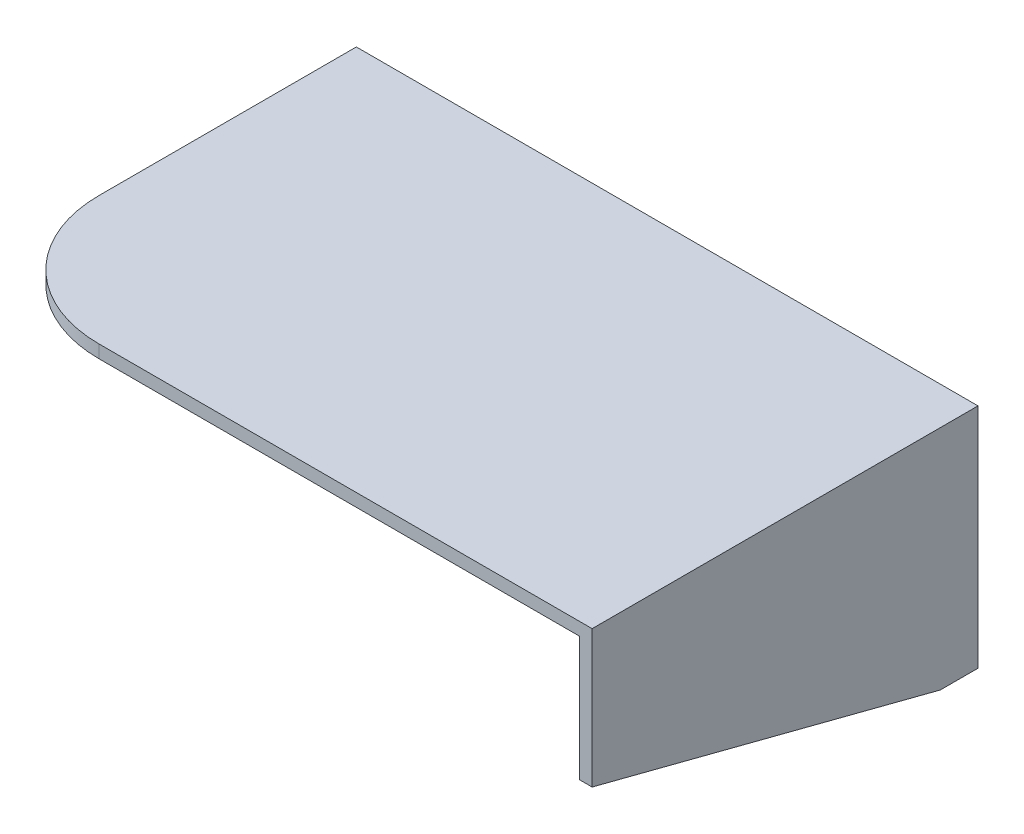
from build123d import *

# Parameters (mm, degrees)
BOSS_EXTRUDE1_DEPTH = 6
BOSS_EXTRUDE2_DEPTH = 90
BOSS_EXTRUDE3_DEPTH = 3
FILLET1_R           = 3
FILLET2_R           = 3
FILLET3_R           = 30
SKETCH4_W           = 4
SKETCH4_H           = 2
CUT_EXTRUDE1_DEPTH  = 136.546495779
CUT_EXTRUDE2_DEPTH  = 175.004604959


with BuildPart() as part:
    # Sketch2 → Boss-Extrude1 (new body)
    with BuildSketch(Plane.XY):
        Polygon((2.5, 4.05), (0, 4.05), (0, -4.05), (10.5, -4.05), (10.5, 30.95), (2.5, 30.95), align=None)
        Polygon((-2.04, 7.95), (0, 7.95), (0, -7.95), (-2.04, -7.95), (-6.152414984, -4.048), (-6.152414984, 4.048), align=None)
    extrude(amount=BOSS_EXTRUDE1_DEPTH)

    # Sketch2<3> → Boss-Extrude2 (add)
    with BuildSketch(Plane.XY):
        Polygon((-49.5, 30.95), (92.5, 30.95), (92.5, -19.05), (95.5, -19.05), (95.5, 33.95), (-49.5, 33.95), align=None)
    extrude(amount=BOSS_EXTRUDE2_DEPTH)

    # Sketch2<4> → Boss-Extrude3 (add)
    with BuildSketch(Plane.XY):
        Polygon((10.5, 30.95), (10.5, -4.05), (10.5, -19.05), (92.5, -19.05), (92.5, 30.95), (30.5, 30.95), align=None)
    extrude(amount=BOSS_EXTRUDE3_DEPTH)

    # Fillet1
    fillet1_edges = [part.edges().sort_by_distance(p)[0] for p in [
        (10.5, 13.45, 3),
    ]]
    fillet(fillet1_edges, radius=FILLET1_R - 0.0001)  # a hair under: the kernel refuses the full size

    # Fillet2
    fillet2_edges = [part.edges().sort_by_distance(p)[0] for p in [
        (10.5, 13.45, 6),
    ]]
    fillet(fillet2_edges, radius=FILLET2_R)

    # Fillet3
    fillet3_edges = [part.edges().sort_by_distance(p)[0] for p in [
        (-49.5, 32.45, 90),
    ]]
    fillet(fillet3_edges, radius=FILLET3_R)

    # Sketch4 → Cut-Extrude1 (cut, through all)
    with BuildSketch(Plane(origin=(0, 0, 0), x_dir=(-1, 0, 0), z_dir=(0, 0, -1))):
        with Locations((4.152414984, 0)):
            Rectangle(SKETCH4_W, SKETCH4_H)
    extrude(amount=-CUT_EXTRUDE1_DEPTH, mode=Mode.SUBTRACT)

    # Sketch5 → Cut-Extrude2 (cut, through all)
    with BuildSketch(Plane(origin=(95.5, 0, 0), x_dir=(0, 0, -1), z_dir=(1, 0, 0))):
        Polygon((-8.799025007, -19.05), (-90, 1.95), (-90, -19.05), align=None)
    extrude(amount=-CUT_EXTRUDE2_DEPTH, mode=Mode.SUBTRACT)


solid = part.part
